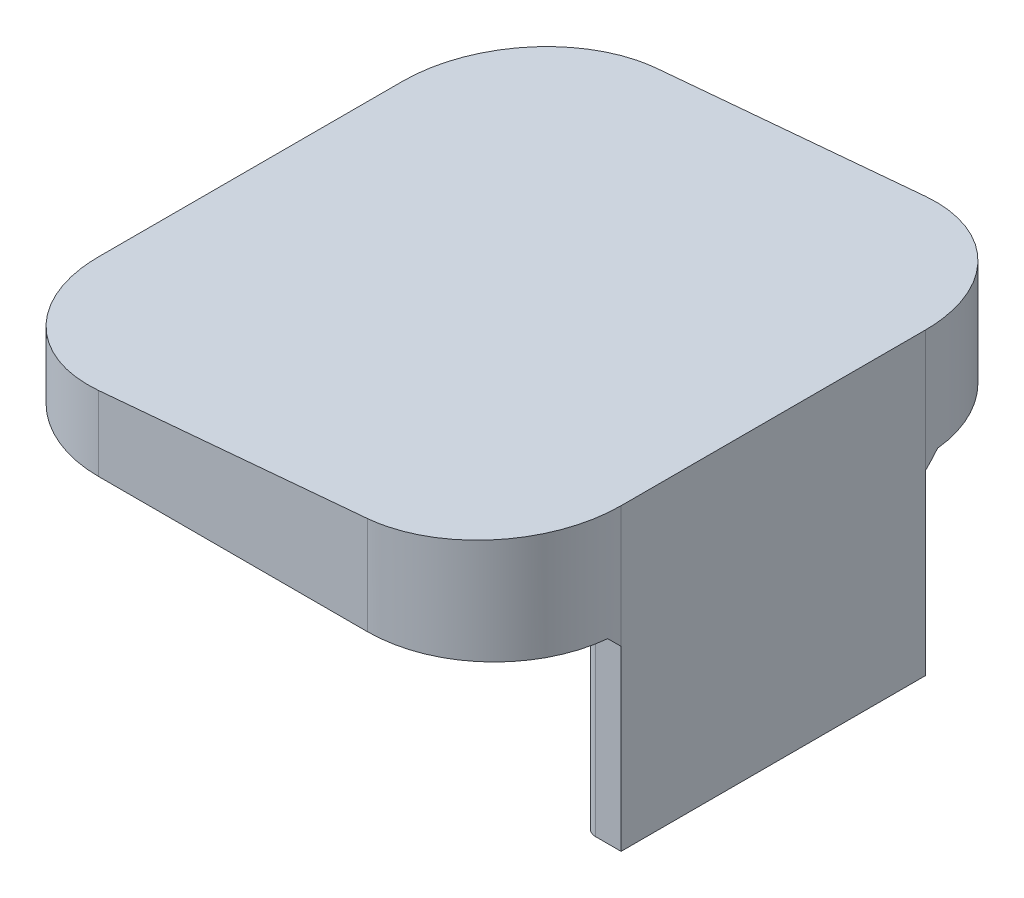
from build123d import *

# Parameters (mm, degrees)
BOSS_EXTRUDE1_DEPTH = 44
FILLET1_R           = 10
SKETCH5_W           = 3
SKETCH5_H           = 24
BOSS_EXTRUDE3_DEPTH = 15
FILLET4_R           = 1
CHAMFER3_SIZE       = 1


with BuildPart() as part:
    # Sketch1 → Boss-Extrude1 (new body)
    with BuildSketch(Plane.XY):
        Polygon((-20.6, 0), (20.6, 0), (20.6, 8.604532937), (-20.6, 5), align=None)
    extrude(amount=BOSS_EXTRUDE1_DEPTH)

    # Fillet1
    fillet1_edges = [part.edges().sort_by_distance(p)[0] for p in [
        (20.6, 4.302266469, 44),
        (-20.6, 2.5, 44),
        (20.6, 4.302266469, 0),
        (-20.6, 2.5, 0),
    ]]
    fillet(fillet1_edges, radius=FILLET1_R)

    # Sketch5 → Boss-Extrude3 (add)
    with BuildSketch(Plane.XZ):
        with Locations((19.1, 22)):
            Rectangle(SKETCH5_W, SKETCH5_H)
    extrude(amount=BOSS_EXTRUDE3_DEPTH)

    # Fillet4
    fillet4_edges = [part.edges().sort_by_distance(p)[0] for p in [
        (17.6, -7.5, 34),
        (17.6, -7.5, 10),
    ]]
    fillet(fillet4_edges, radius=FILLET4_R)

    # Chamfer3
    # the kernel refuses this chamfer: 1 mm, written as the material it adds along each edge
    with BuildSketch(Plane(origin=(17.6, 0, 11), x_dir=(-0.9996219169112952, 0.027495876610644465, 0), z_dir=(0, 0, 1))) as chamfer3_piece_1:
        Polygon((CHAMFER3_SIZE * 0.999621916911, CHAMFER3_SIZE * 0.0274958766106), (-CHAMFER3_SIZE * 0.0274958766106, CHAMFER3_SIZE * 0.999621916911), (0, 0), align=None)
    extrude(amount=22)
    with BuildSketch(Plane(origin=(18.6, 0, 34), x_dir=(0, 0.027495876610647806, 0.999621916911295), z_dir=(1, 0, 0))) as chamfer3_piece_2_section:
        Polygon((CHAMFER3_SIZE * 0.999621916911, CHAMFER3_SIZE * 0.0274958766106), (-CHAMFER3_SIZE * 0.0274958766106, CHAMFER3_SIZE * 0.999621916911), (0, 0), align=None)
    chamfer3_piece_2 = extrude(amount=4.571682988, mode=Mode.PRIVATE)
    chamfer3_piece_2 = chamfer3_piece_2 & Plane(origin=(10.6, -0.333892015, 34), x_dir=(1, 0, 0), z_dir=(0, 1, 0)) * Cylinder(10, 14, mode=Mode.PRIVATE)
    add(chamfer3_piece_2)
    with BuildSketch(Plane(origin=(23.171682988, 0, 10), x_dir=(0, 0.02749587661058639, -0.9996219169112968), z_dir=(-1, 0, 0))) as chamfer3_piece_3_section:
        Polygon((CHAMFER3_SIZE * 0.999621916911, CHAMFER3_SIZE * 0.0274958766106), (-CHAMFER3_SIZE * 0.0274958766106, CHAMFER3_SIZE * 0.999621916911), (0, 0), align=None)
    chamfer3_piece_3 = extrude(amount=4.571682988, mode=Mode.PRIVATE)
    chamfer3_piece_3 = chamfer3_piece_3 & Plane(origin=(10.6, -0.333892015, 10), x_dir=(1, 0, 0), z_dir=(0, 1, 0)) * Cylinder(10, 14, mode=Mode.PRIVATE)
    add(chamfer3_piece_3)
    with BuildSketch(Plane(origin=(18.6, 0, 33), x_dir=(-1, 0, 0), z_dir=(0, 0, -1))) as chamfer3_piece_4:
        Polygon((1 + CHAMFER3_SIZE, 0), (1, -CHAMFER3_SIZE), (1, 0), align=None)
    revolve(axis=Axis((18.6, 0, 33), (0, 1, 0)), revolution_arc=90)
    with BuildSketch(Plane(origin=(18.6, 0, 11), x_dir=(0, 0, -1), z_dir=(1, 0, 0))) as chamfer3_piece_5:
        Polygon((1 + CHAMFER3_SIZE, 0), (1, -CHAMFER3_SIZE), (1, 0), align=None)
    revolve(axis=Axis((18.6, 0, 11), (0, 1, 0)), revolution_arc=90)


solid = part.part
